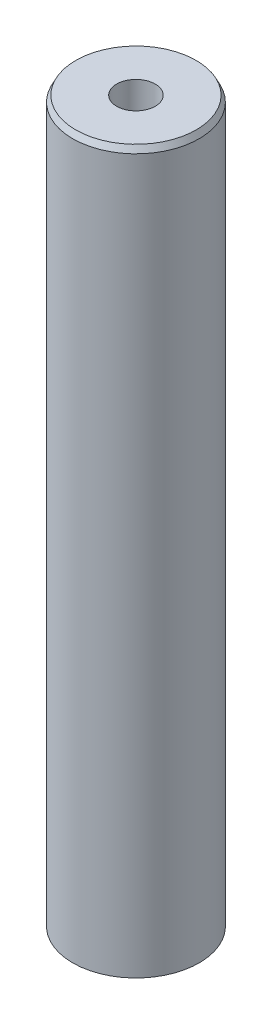
from build123d import *
from OCP.BRepFilletAPI import BRepFilletAPI_MakeChamfer

# Parameters (mm, degrees)
SKETCH1_R           = 52.5
BOSS_EXTRUDE1_DEPTH = 600
SKETCH2_R           = 16.023131756
CUT_EXTRUDE1_DEPTH  = 605.576297914
CHAMFER1_SIZE       = 5.063511564
CHAMFER1_SIZE2      = 2.528190338


with BuildPart() as part:
    # Sketch1 → Boss-Extrude1 (new body)
    with BuildSketch(Plane(origin=(0, 0, 0), x_dir=(1, 0, 0), z_dir=(0, 1, 0))):
        Circle(SKETCH1_R)
    extrude(amount=BOSS_EXTRUDE1_DEPTH)

    # Sketch2 → Cut-Extrude1 (cut, through all)
    with BuildSketch(Plane(origin=(0, 0, 0), x_dir=(1, 0, 0), z_dir=(0, 1, 0))):
        Circle(SKETCH2_R)
    extrude(amount=CUT_EXTRUDE1_DEPTH, mode=Mode.SUBTRACT)

    # Chamfer1: one chamfer whose edges measure the first distance from different faces: ONE call of the kernel's chamfer builder (chamfer() names one face for all edges)
    chamfer1_edges_1 = [part.edges().sort_by_distance(p)[0] for p in [
        (-52.5, 600, 0),
    ]]
    chamfer1_side_1 = [part.faces().sort_by_distance(p)[0] for p in [
        (-52.5, 300, 0),
    ]]
    chamfer1_edges_2 = [part.edges().sort_by_distance(p)[0] for p in [
        (-52.5, 0, 0),
    ]]
    chamfer1_side_2 = [part.faces().sort_by_distance(p)[0] for p in [
        (-51.01507576, 0, 0),
    ]]
    chamfer1 = BRepFilletAPI_MakeChamfer(part.part.solid().wrapped)
    for e in chamfer1_edges_1:
        chamfer1.Add(CHAMFER1_SIZE, CHAMFER1_SIZE2, e.wrapped, chamfer1_side_1[0].wrapped)  # the first distance lies on this face
    for e in chamfer1_edges_2:
        chamfer1.Add(CHAMFER1_SIZE, CHAMFER1_SIZE2, e.wrapped, chamfer1_side_2[0].wrapped)  # the first distance lies on this face
    add(Compound.cast(chamfer1.Shape()), mode=Mode.REPLACE)


solid = part.part
